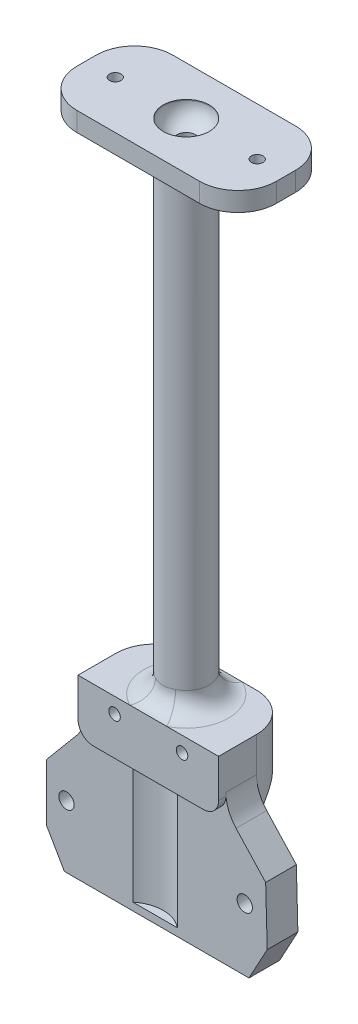
from build123d import *

# Parameters (mm, degrees)
SKETCH_1_W           = 52
SKETCH_1_H           = 25
SKETCH_1_R           = 1.5
EXTRUDE_1_DEPTH      = 5
SKETCH_2_R           = 4
SKETCH_2_R_2         = 2.5
EXTRUDE_2_DEPTH      = 125
FILLET_1_R           = 10
SKETCH_2_3_R         = 6
SKETCH_2_3_R_2       = 4
EXTRUDE_4_DEPTH      = 125
FILLET_3_R           = 5
CUT_EXTRUDE_START    = -50
SKETCH_2_4_R         = 6
CUT_EXTRUDE_1_DEPTH  = 50
FILLET_4_R           = 5
EXTRUDE_5_DEPTH      = 23
EXTRUDE_5_DEPTH_BACK = 10
SKETCH_3_W           = 36.659715442
SKETCH_3_H           = 13
SKETCH_4_W           = 12.2
SKETCH_4_H           = 10.2
CUT_EXTRUDE_2_DEPTH  = 16
FILLET_5_R           = 10
EXTRUDE_6_DEPTH      = 8
FILLET_7_R           = 10
FILLET_8_R           = 10
SKETCH_9_R           = 9
SKETCH_9_R_2         = 2.5
CUT_EXTRUDE_4_DEPTH  = 35
SKETCH_10_W          = 48.137224848
SKETCH_10_H          = 8
EXTRUDE_9_DEPTH      = 2
FILLET_9_R           = 5
CUT_EXTRUDE_5_REACH  = 178.626
SKETCH_8_R           = 2
CUT_EXTRUDE_6_REACH  = 149.735
SKETCH_11_W          = 37.875915136
SKETCH_11_H          = 13.1
EXTRUDE_START        = 1
EXTRUDE_10_DEPTH     = 1
CUT_EXTRUDE_7_REACH  = 178.857
SKETCH_13_R          = 1.5
CUT_EXTRUDE_8_DEPTH  = 4
FILLET_11_R          = 4
SKETCH_16_R          = 1.25
CUT_EXTRUDE_10_DEPTH = 4


# Some blends are built 0.0001 mm under size
with BuildPart() as part:
    # 草图1 → 凸台-拉伸1 (new body)
    with BuildSketch(Plane(origin=(0, 0, 0), x_dir=(1, 0, 0), z_dir=(0, 1, 0))):
        Rectangle(SKETCH_1_W, SKETCH_1_H)
        with Locations(Location((-18.5, 0, 0), (0, 0, 270))):
            Circle(SKETCH_1_R, mode=Mode.SUBTRACT)
        with Locations(Location((18.5, 0, 0), (0, 0, 270))):
            Circle(SKETCH_1_R, mode=Mode.SUBTRACT)
    extrude(amount=EXTRUDE_1_DEPTH)

    # 草图2 → 凸台-拉伸2 (add)
    with BuildSketch(Plane.XZ):
        with Locations(Location((0, 0, 0), (0, 0, 90))):
            Circle(SKETCH_2_R)
        with Locations(Location((0, 0, 0), (0, 0, 270))):
            Circle(SKETCH_2_R_2, mode=Mode.SUBTRACT)
    extrude(amount=EXTRUDE_2_DEPTH)

    # 圆角1
    fillet_1_edges = [part.edges().sort_by_distance(p)[0] for p in [
        (26, 2.5, 12.5),
        (-26, 2.5, 12.5),
        (-26, 2.5, -12.5),
        (26, 2.5, -12.5),
    ]]
    fillet(fillet_1_edges, radius=FILLET_1_R)

    # 草图2<3> → 凸台-拉伸4 (add)
    with BuildSketch(Plane.XZ):
        with Locations(Location((0, 0, 0), (0, 0, 90))):
            Circle(SKETCH_2_3_R)
        Circle(SKETCH_2_3_R_2, mode=Mode.SUBTRACT)
    extrude(amount=EXTRUDE_4_DEPTH)

    # 圆角3
    fillet_3_edges = [part.edges().sort_by_distance(p)[0] for p in [
        (0, 0, -6),
    ]]
    fillet(fillet_3_edges, radius=FILLET_3_R)

    # 草图2<4> → 切除-拉伸1 (cut)
    with BuildSketch(Plane.XZ.offset(CUT_EXTRUDE_START)):
        with Locations(Location((0, 0, 0), (0, 0, 90))):
            Circle(SKETCH_2_4_R)
    extrude(amount=CUT_EXTRUDE_1_DEPTH, mode=Mode.SUBTRACT)

    # 圆角4
    # the kernel refuses this fillet: 5 mm, written as the material it adds along each edge
    with BuildSketch(Plane(origin=(0, 0, 0), x_dir=(0, 0, 1), z_dir=(1, 0, 0))) as fillet_4_piece_1:
        with BuildLine():
            CenterArc((1, -4.769696007), FILLET_4_R, 0, 72.542396876)
            Line((2.5, 0), (2.53, 0.09539392))
            ThreePointArc((2.53, 0.09539392), (4.25, 0.1), (6, 0.1))
            Line((6, 0.1), (6.1, 0))
            Line((6.1, 0), (6.1, -4.769696007))
            Line((6.1, -4.769696007), (6, -4.769696007))
        make_face()
    revolve(axis=Axis((0, 0, 0), (0, -1, 0)))

    # 草图3 → 凸台-拉伸5 (add, two sides: drawn at the far end of the back side and taken through both)
    with BuildSketch(Plane.XY.offset(-EXTRUDE_5_DEPTH_BACK)):
        with Locations((0, -131.5)):
            Rectangle(SKETCH_3_W, SKETCH_3_H)
    extrude(amount=EXTRUDE_5_DEPTH + EXTRUDE_5_DEPTH_BACK)

    # 草图4 → 切除-拉伸2 (cut)
    with BuildSketch(Plane(origin=(0, -125, 0), x_dir=(1, 0, 0), z_dir=(0, 1, 0))):
        with Locations((0, -15)):
            Rectangle(SKETCH_4_W, SKETCH_4_H)
    extrude(amount=-CUT_EXTRUDE_2_DEPTH, mode=Mode.SUBTRACT)

    # 圆角5
    fillet_5_edges = [part.edges().sort_by_distance(p)[0] for p in [
        (18.329857721, -131.5, -10),
        (-18.329857721, -131.5, -10),
        (18.329857721, -131.5, 23),
        (-18.329857721, -131.5, 23),
    ]]
    fillet(fillet_5_edges, radius=FILLET_5_R)

    # 草图5 → 凸台-拉伸6 (add)
    with BuildSketch(Plane.XY):
        Polygon((-18.329857721, -138), (-28.399053295, -150), (-28.399053295, -165), (-23.780251142, -173), (0.468760608, -173), (24.356973706, -173), (29.111967808, -164.22974568), (28.710245061, -149.235126017), (18.329857721, -138), align=None)
    extrude(amount=EXTRUDE_6_DEPTH)

    # 圆角7
    # the kernel refuses this fillet: 10 mm, written as the material it adds along each edge
    with BuildSketch(Plane(origin=(18.329857721, -138, 8), x_dir=(0, 1, 0), z_dir=(0, 0, -1))) as fillet_7_piece_1:
        with BuildLine():
            CenterArc((FILLET_7_R * 0.39124696726, FILLET_7_R), FILLET_7_R, 227.264457783, 42.735542217)
            Line((-FILLET_7_R * 0.287368460715, FILLET_7_R * 0.265506228132), (0, 0))
            Line((0, 0), (FILLET_7_R * 0.39124696726, 0))
        make_face()
    extrude(amount=8)
    with BuildSketch(Plane(origin=(-18.329857721, -138, 0), x_dir=(0, 1, 0), z_dir=(0, 0, 1))) as fillet_7_piece_2:
        with BuildLine():
            CenterArc((FILLET_7_R * 0.363970234266, FILLET_7_R), FILLET_7_R, 230, 40)
            Line((-FILLET_7_R * 0.27881737542, FILLET_7_R * 0.233955556881), (0, 0))
            Line((0, 0), (FILLET_7_R * 0.363970234266, 0))
        make_face()
    extrude(amount=8)

    # 圆角8
    fillet_8_edges = [part.edges().sort_by_distance(p)[0] for p in [
        (0, -138, 0),
    ]]
    fillet(fillet_8_edges, radius=FILLET_8_R - 0.0001)  # a hair under: the kernel refuses the full size

    # 草图9 → 切除-拉伸4 (cut)
    with BuildSketch(Plane.XZ.offset(173)):
        with Locations((-0.1, 14.9)):
            Circle(SKETCH_9_R)
        with Locations((-0.1, 14.9)):
            Circle(SKETCH_9_R_2, mode=Mode.SUBTRACT)
    extrude(amount=-CUT_EXTRUDE_4_DEPTH, mode=Mode.SUBTRACT)

    # 草图10 → 凸台-拉伸9 (add)
    with BuildSketch(Plane.XZ.offset(173)):
        with Locations((0.288361282, 4)):
            Rectangle(SKETCH_10_W, SKETCH_10_H)
    extrude(amount=-EXTRUDE_9_DEPTH)

    # 圆角9
    fillet_9_edges = [part.edges().sort_by_distance(p)[0] for p in [
        (0, -125, -6),
    ]]
    fillet(fillet_9_edges, radius=FILLET_9_R)

    # 草图8 → 切除-拉伸5 (cut, up to next)
    with BuildSketch(Plane.XY.offset(8), mode=Mode.PRIVATE) as cut_extrude_5_sk1:
        with Locations((23.25, -156.732435849)):
            Circle(SKETCH_8_R)
    cut_extrude_5_tool1 = extrude(cut_extrude_5_sk1.sketch, amount=-CUT_EXTRUDE_5_REACH, mode=Mode.PRIVATE) & part.part
    # 草图8 → 切除-拉伸5 (cut, up to next)
    with BuildSketch(Plane.XY.offset(8), mode=Mode.PRIVATE) as cut_extrude_5_sk2:
        with Locations((-23.25, -156.732435849)):
            Circle(SKETCH_8_R)
    cut_extrude_5_tool2 = extrude(cut_extrude_5_sk2.sketch, amount=-CUT_EXTRUDE_5_REACH, mode=Mode.PRIVATE) & part.part
    add(cut_extrude_5_tool1.solids().sort_by_distance((23.25, -156.732436, 8))[0], mode=Mode.SUBTRACT)
    add(cut_extrude_5_tool2.solids().sort_by_distance((-23.25, -156.732436, 8))[0], mode=Mode.SUBTRACT)

    # 草图11 → 切除-拉伸6 (cut, up to next)
    with BuildSketch(Plane.XZ.offset(138), mode=Mode.PRIVATE) as cut_extrude_6_sk1:
        with Locations((-0.053616604, 16.45)):
            Rectangle(SKETCH_11_W, SKETCH_11_H)
    cut_extrude_6_tool1 = extrude(cut_extrude_6_sk1.sketch, amount=-CUT_EXTRUDE_6_REACH, mode=Mode.PRIVATE) & part.part
    add(cut_extrude_6_tool1.solids().sort_by_distance((-0.053617, -138, 16.45))[0], mode=Mode.SUBTRACT)

    # 草图12 → 凸台-拉伸10 (add)
    with BuildSketch(Plane.XZ.offset(138).offset(EXTRUDE_START)):
        with BuildLine():
            Line((18.329857721, 9.9), (-18.329857721, 9.9))
            Line((-18.329857721, 9.9), (-18.329857721, 8))
            Line((-18.329857721, 8), (-5.878408085, 8))
            ThreePointArc((-5.878408085, 8), (-0.1, 5.9), (5.678408085, 8))
            Line((5.678408085, 8), (18.329857721, 8))
            Line((18.329857721, 8), (18.329857721, 9.9))
        make_face()
    extrude(amount=-EXTRUDE_10_DEPTH)

    # 草图13 → 切除-拉伸7 (cut, up to next)
    with BuildSketch(Plane.XY.offset(9.9), mode=Mode.PRIVATE) as cut_extrude_7_sk1:
        with Locations((-8.8, -129)):
            Circle(SKETCH_13_R)
    cut_extrude_7_tool1 = extrude(cut_extrude_7_sk1.sketch, amount=-CUT_EXTRUDE_7_REACH, mode=Mode.PRIVATE) & part.part
    # 草图13 → 切除-拉伸7 (cut, up to next)
    with BuildSketch(Plane.XY.offset(9.9), mode=Mode.PRIVATE) as cut_extrude_7_sk2:
        with Locations((8.8, -129)):
            Circle(SKETCH_13_R)
    cut_extrude_7_tool2 = extrude(cut_extrude_7_sk2.sketch, amount=-CUT_EXTRUDE_7_REACH, mode=Mode.PRIVATE) & part.part
    add(cut_extrude_7_tool1.solids().sort_by_distance((-8.8, -129, 9.9))[0], mode=Mode.SUBTRACT)
    add(cut_extrude_7_tool2.solids().sort_by_distance((8.8, -129, 9.9))[0], mode=Mode.SUBTRACT)

    # 草图14 → 切除-拉伸8 (cut)
    with BuildSketch(Plane(origin=(0, 0, -10), x_dir=(-1, 0, 0), z_dir=(0, 0, -1))):
        Polygon((-6.05, -130.58771324), (-6.05, -127.41228676), (-8.8, -125.824573519), (-11.55, -127.41228676), (-11.55, -130.58771324), (-8.8, -132.175426481), align=None)
        Polygon((6.05, -130.58771324), (6.05, -127.41228676), (8.8, -125.824573519), (11.55, -127.41228676), (11.55, -130.58771324), (8.8, -132.175426481), align=None)
    extrude(amount=-CUT_EXTRUDE_8_DEPTH, mode=Mode.SUBTRACT)

    # 圆角11
    fillet_11_edges = [part.edges().sort_by_distance(p)[0] for p in [
        (18.329857721, -139, 8.95),
        (-18.329857721, -139, 8.95),
    ]]
    fillet(fillet_11_edges, radius=FILLET_11_R)

    # 草图16 → 切除-拉伸10 (cut)
    with BuildSketch(Plane(origin=(0, 0, 0), x_dir=(-1, 0, 0), z_dir=(0, 0, -1))):
        with Locations((-5.288361282, -167)):
            Circle(SKETCH_16_R)
        with Locations(Location((4.711638718, -167, 0), (0, 0, 180))):
            Circle(SKETCH_16_R)
    extrude(amount=-CUT_EXTRUDE_10_DEPTH, mode=Mode.SUBTRACT)


solid = part.part
